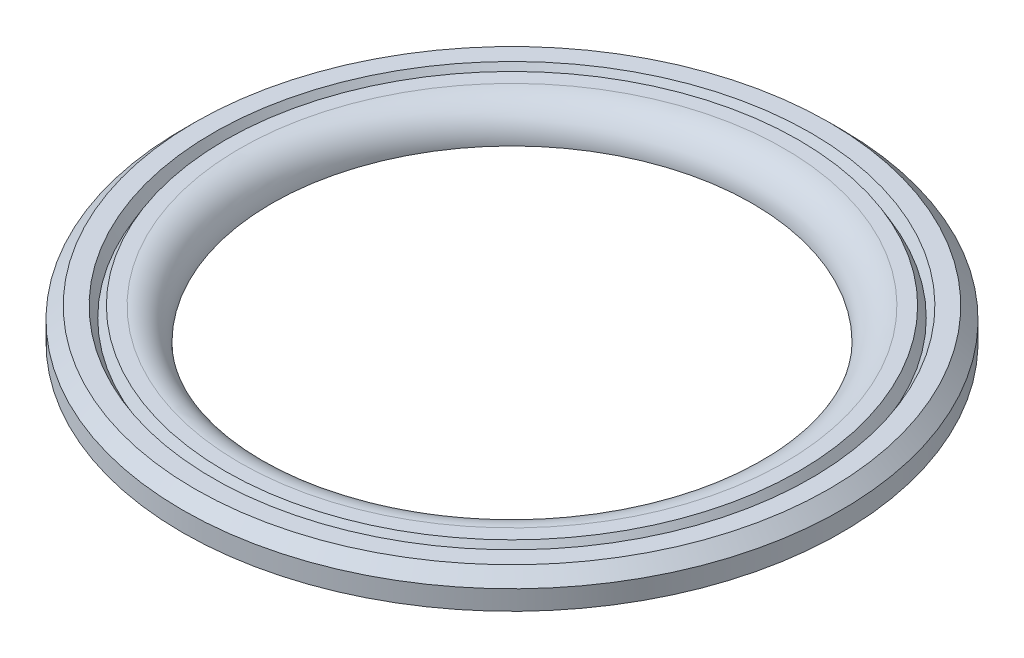
from build123d import *

# Parameters (mm, degrees)
SKETCH1_R           = 27
SKETCH1_R_2         = 19.7
BOSS_EXTRUDE1_DEPTH = 2.6
FILLET1_R           = 2.6
CHAMFER1_SIZE       = 1


with BuildPart() as part:
    # Sketch1 → Boss-Extrude1 (new body)
    with BuildSketch(Plane(origin=(0, 0, 0), x_dir=(1, 0, 0), z_dir=(0, 1, 0))):
        with Locations(Location((0, 0, 0), (0, 0, 270))):
            Circle(SKETCH1_R)
        with Locations(Location((0, 0, 0), (0, 0, 270))):
            Circle(SKETCH1_R_2, mode=Mode.SUBTRACT)
    extrude(amount=BOSS_EXTRUDE1_DEPTH)

    # Fillet1
    fillet1_edges = [part.edges().sort_by_distance(p)[0] for p in [
        (0, 2.6, -19.7),
    ]]
    fillet(fillet1_edges, radius=FILLET1_R - 0.0001)  # a hair under: the kernel refuses the full size

    # Chamfer1
    chamfer1_edges = [part.edges().sort_by_distance(p)[0] for p in [
        (0, 2.6, -27),
    ]]
    chamfer(chamfer1_edges, length=CHAMFER1_SIZE)

    # Cut-Sweep1: sweep along a curve in space
    with BuildLine() as cut_sweep1_path:
        ThreePointArc((0, 0, 19.7), (13.930003589, 0, 13.930003589), (19.7, 0, 0))
        ThreePointArc((19.7, 0, 0), (13.930003589, 0, -13.930003589), (0, 0, -19.7))
        ThreePointArc((0, 0, -19.7), (-13.930003589, 0, -13.930003589), (-19.7, 0, 0))
        ThreePointArc((-19.7, 0, 0), (-13.930003589, 0, 13.930003589), (0, 0, 19.7))
    # Sketch2 → Cut-Sweep1 (sweep, cut)
    with BuildSketch(Plane(origin=(0, 0, 0), x_dir=(0, 0, -1), z_dir=(1, 0, 0))):
        Polygon((24.5, 2.6), (24, 1.733974596), (23.5, 2.6), align=None)
    sweep(path=cut_sweep1_path.line, mode=Mode.SUBTRACT)


solid = part.part
